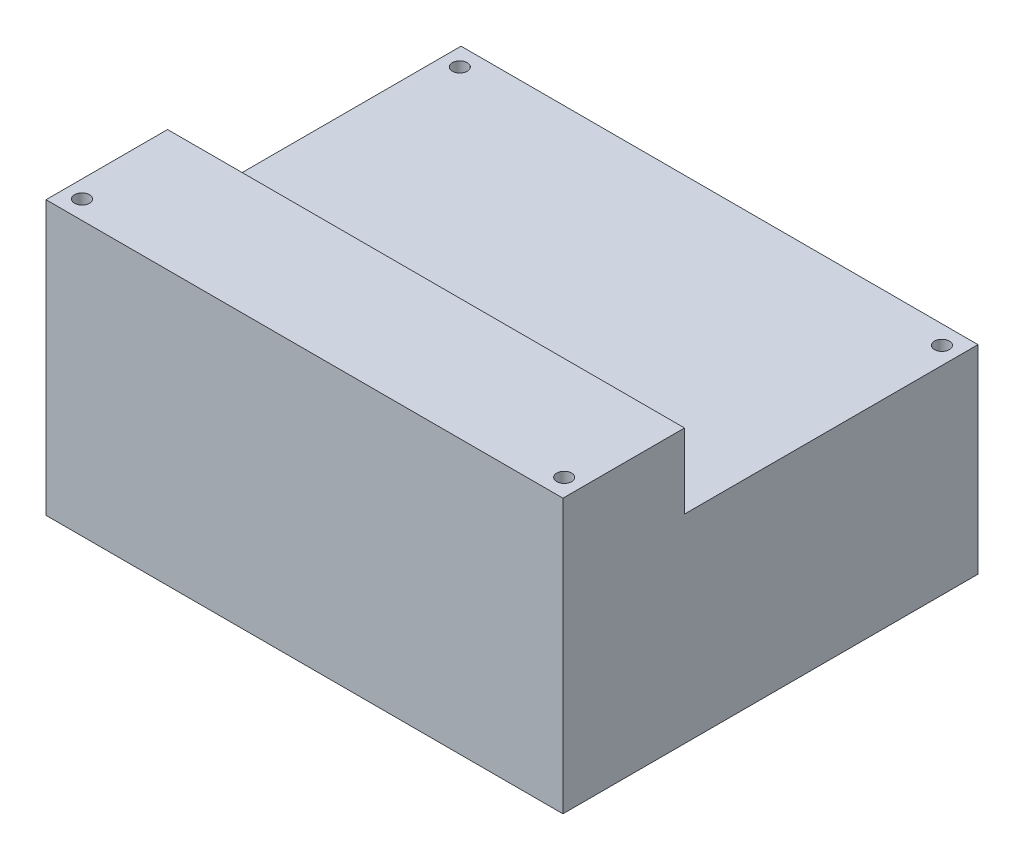
from build123d import *

# Parameters (mm, degrees)
SKETCH1_W           = 104
SKETCH1_H           = 83.5
BOSS_EXTRUDE1_DEPTH = 55
SKETCH2_W           = 59.042208754
SKETCH2_H           = 15
CUT_EXTRUDE1_DEPTH  = 145.267979815
SKETCH3_R           = 1.5
CUT_EXTRUDE2_DEPTH  = 145.267979815


with BuildPart() as part:
    # Sketch1 → Boss-Extrude1 (new body)
    with BuildSketch(Plane(origin=(0, 0, 0), x_dir=(1, 0, 0), z_dir=(0, 1, 0))):
        with Locations((52, 41.75)):
            Rectangle(SKETCH1_W, SKETCH1_H)
    extrude(amount=BOSS_EXTRUDE1_DEPTH)

    # Sketch2 → Cut-Extrude1 (cut, through all)
    with BuildSketch(Plane(origin=(104, 0, 0), x_dir=(0, 0, -1), z_dir=(1, 0, 0))):
        with Locations((53.978895623, 47.5)):
            Rectangle(SKETCH2_W, SKETCH2_H)
    extrude(amount=-CUT_EXTRUDE1_DEPTH, mode=Mode.SUBTRACT)

    # Sketch3 → Cut-Extrude2 (cut, through all)
    with BuildSketch(Plane.XZ):
        with Locations((3.5, -79.75)):
            Circle(SKETCH3_R)
        with Locations((3.5, -3.75)):
            Circle(SKETCH3_R)
        with Locations((100.5, -3.75)):
            Circle(SKETCH3_R)
        with Locations((100.5, -79.75)):
            Circle(SKETCH3_R)
    extrude(amount=-CUT_EXTRUDE2_DEPTH, mode=Mode.SUBTRACT)


solid = part.part
